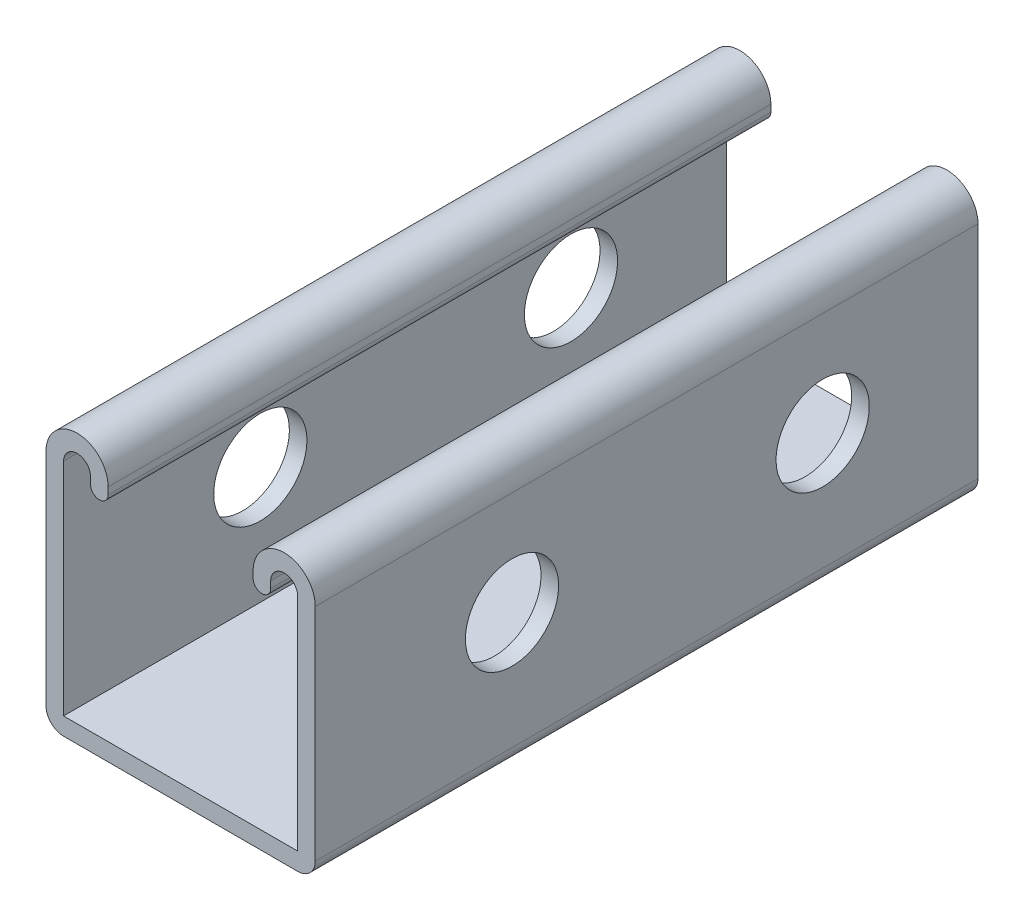
from build123d import *

# Parameters (mm, degrees)
BASE_EXTRUDE_DEPTH                        = 101.6
HOLE1_START                               = -20.6375
HOLE1_OUTLINE_R                           = 7.14375
HOLE1_DEPTH                               = 2.6924
LPATTERN1_COUNT                           = 2
LPATTERN1_PITCH                           = 47.625
CIRPATTERN1_COUNT                         = 2
CIRPATTERN1_ANGLE                         = 90
CIRPATTERN1_START                         = -20.6375
CIRPATTERN1_COPY_1_SKETCH_R               = 7.14375
CIRPATTERN1_COPY_1_DEPTH                  = 2.6924
CIRPATTERN1_THE_OTHER_WAY_COUNT           = 2
CIRPATTERN1_THE_OTHER_WAY_ANGLE           = 90
CIRPATTERN1_THE_OTHER_WAY_COPY_1_SKETCH_R = 7.14375
CIRPATTERN1_THE_OTHER_WAY_COPY_1_DEPTH    = 2.6924


# Read off the part's stored shape, not the designer's step: Hole1
with BuildPart() as part:
    # Sketch1 → Base-Extrude (new body)
    with BuildSketch(Plane.XY):
        with BuildLine():
            Line((-20.6375, 15.875), (-20.6375, -17.9451))
            ThreePointArc((-20.6375, -17.9451), (-19.848914298, -19.848914298), (-17.9451, -20.6375))
            Line((-17.9451, -20.6375), (17.9451, -20.6375))
            ThreePointArc((17.9451, -20.6375), (19.848914298, -19.848914298), (20.6375, -17.9451))
            Line((20.6375, -17.9451), (20.6375, 15.875))
            ThreePointArc((20.6375, 15.875), (15.875, 20.6375), (11.1125, 15.875))
            Line((11.1125, 15.875), (11.1125, 14.83995))
            ThreePointArc((11.1125, 14.83995), (12.4587, 13.49375), (13.8049, 14.83995))
            Line((13.8049, 14.83995), (13.8049, 15.875))
            ThreePointArc((13.8049, 15.875), (15.875, 17.9451), (17.9451, 15.875))
            Line((17.9451, 15.875), (17.9451, -17.9451))
            Line((17.9451, -17.9451), (-17.9451, -17.9451))
            Line((-17.9451, -17.9451), (-17.9451, 15.875))
            ThreePointArc((-17.9451, 15.875), (-15.875, 17.9451), (-13.8049, 15.875))
            Line((-13.8049, 15.875), (-13.8049, 14.83995))
            ThreePointArc((-13.8049, 14.83995), (-12.4587, 13.49375), (-11.1125, 14.83995))
            Line((-11.1125, 14.83995), (-11.1125, 15.875))
            ThreePointArc((-11.1125, 15.875), (-15.875, 20.6375), (-20.6375, 15.875))
        make_face()
    extrude(amount=BASE_EXTRUDE_DEPTH)

    # Hole1 outline → Hole1 (cut)
    with BuildSketch(Plane(origin=(0, 0, 0), x_dir=(1, 0, 0), z_dir=(0, 1, 0)).offset(HOLE1_START)):
        with Locations((0, -23.8125)):
            Circle(HOLE1_OUTLINE_R)
    hole1 = extrude(amount=HOLE1_DEPTH, mode=Mode.SUBTRACT)

    # LPattern1: Hole1 ×2
    with Locations(*[(0, 0, i * LPATTERN1_PITCH) for i in range(1, LPATTERN1_COUNT)]):
        add(hole1, mode=Mode.SUBTRACT)

    # CirPattern1: Hole1 ×2 about axis
    cirpattern1_axis = Axis((0, 0, -50), (0, 0, 1))
    for i in range(1, CIRPATTERN1_COUNT):
        add(hole1.rotate(cirpattern1_axis, i * CIRPATTERN1_ANGLE / (CIRPATTERN1_COUNT - 1)), mode=Mode.SUBTRACT)

    # CirPattern1 copy 1 sketch → CirPattern1 copy 1 (cut)
    with BuildSketch(Plane(origin=(0, 0, 47.625), x_dir=(0, 1, 0), z_dir=(-1, 0, 0)).offset(CIRPATTERN1_START)):
        with Locations((0, -23.8125)):
            Circle(CIRPATTERN1_COPY_1_SKETCH_R)
    extrude(amount=CIRPATTERN1_COPY_1_DEPTH, mode=Mode.SUBTRACT)

    # CirPattern1 the other way: Hole1 ×2 about axis
    cirpattern1_the_other_way_axis = Axis((0, 0, -50), (0, 0, -1))
    for i in range(1, CIRPATTERN1_THE_OTHER_WAY_COUNT):
        add(hole1.rotate(cirpattern1_the_other_way_axis, i * CIRPATTERN1_THE_OTHER_WAY_ANGLE / (CIRPATTERN1_THE_OTHER_WAY_COUNT - 1)), mode=Mode.SUBTRACT)

    # CirPattern1 the other way copy 1 sketch → CirPattern1 the other way copy 1 (cut)
    with BuildSketch(Plane(origin=(0, 0, 47.625), x_dir=(0, -1, 0), z_dir=(1, 0, 0)).offset(CIRPATTERN1_START)):
        with Locations((0, -23.8125)):
            Circle(CIRPATTERN1_THE_OTHER_WAY_COPY_1_SKETCH_R)
    extrude(amount=CIRPATTERN1_THE_OTHER_WAY_COPY_1_DEPTH, mode=Mode.SUBTRACT)


solid = part.part
